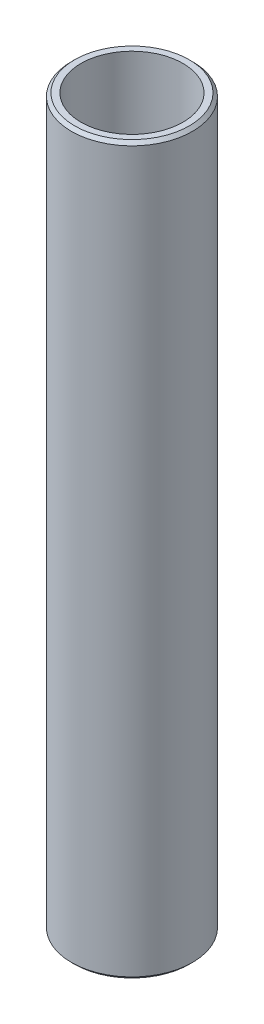
from build123d import *

# Parameters (mm, degrees)
SKETCH1_R           = 50
BOSS_EXTRUDE1_DEPTH = 600
SKETCH2_R           = 42.136268807
CUT_EXTRUDE1_DEPTH  = 605.15229868
CHAMFER1_SIZE       = 2.628432673


with BuildPart() as part:
    # Sketch1 → Boss-Extrude1 (new body)
    with BuildSketch(Plane(origin=(0, 0, 0), x_dir=(1, 0, 0), z_dir=(0, 1, 0))):
        Circle(SKETCH1_R)
    extrude(amount=BOSS_EXTRUDE1_DEPTH)

    # Sketch2 → Cut-Extrude1 (cut, through all)
    with BuildSketch(Plane(origin=(0, 0, 0), x_dir=(1, 0, 0), z_dir=(0, 1, 0))):
        Circle(SKETCH2_R)
    extrude(amount=CUT_EXTRUDE1_DEPTH, mode=Mode.SUBTRACT)

    # Chamfer1
    chamfer1_edges = [part.edges().sort_by_distance(p)[0] for p in [
        (-50, 600, 0),
        (-50, 0, 0),
    ]]
    chamfer(chamfer1_edges, length=CHAMFER1_SIZE)


solid = part.part
